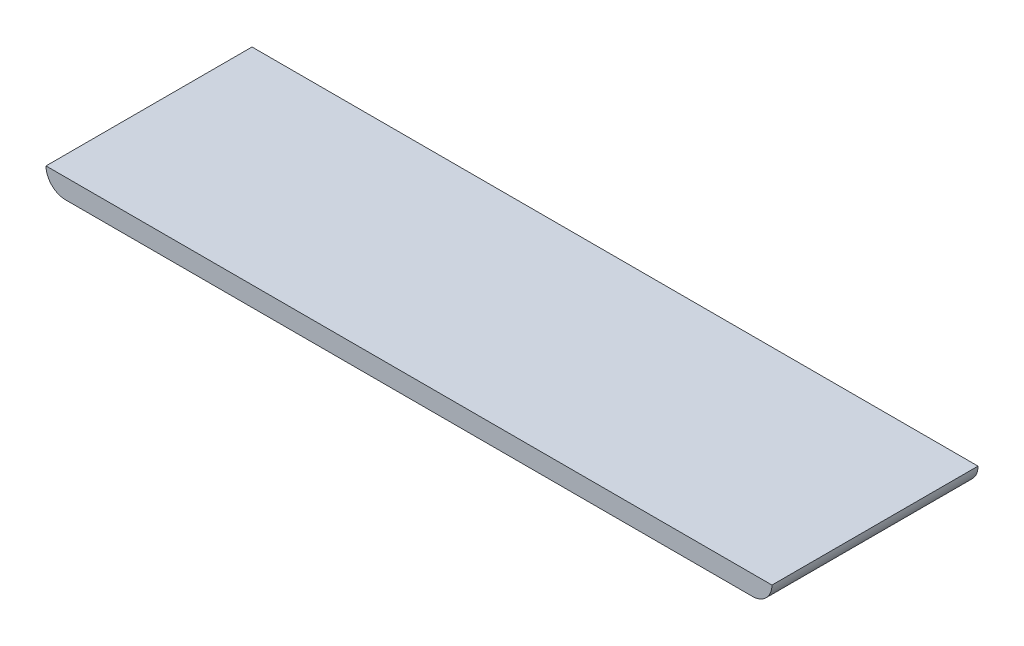
from build123d import *

# Parameters (mm, degrees)
SKETCH_1_W                       = 111
SKETCH_1_H                       = 31.5
EXTRUDE_1_DEPTH                  = 3
TOOL_D3_R3_FRONT_OUTER_CORNERS_R = 3


with BuildPart() as part:
    # Эскиз1 → Бобышка-Вытянуть1 (new body)
    with BuildSketch(Plane(origin=(0, 0, 0), x_dir=(1, 0, 0), z_dir=(0, 1, 0))):
        with Locations((53.5, -15.75)):
            Rectangle(SKETCH_1_W, SKETCH_1_H)
    extrude(amount=EXTRUDE_1_DEPTH)

    # tool_D3_R3_front_outer_corners
    tool_d3_r3_front_outer_corners_edges = [part.edges().sort_by_distance(p)[0] for p in [
        (-2, 0, 15.75),
        (109, 0, 15.75),
    ]]
    fillet(tool_d3_r3_front_outer_corners_edges, radius=TOOL_D3_R3_FRONT_OUTER_CORNERS_R - 0.0001)  # a hair under: the kernel refuses the full size


solid = part.part
